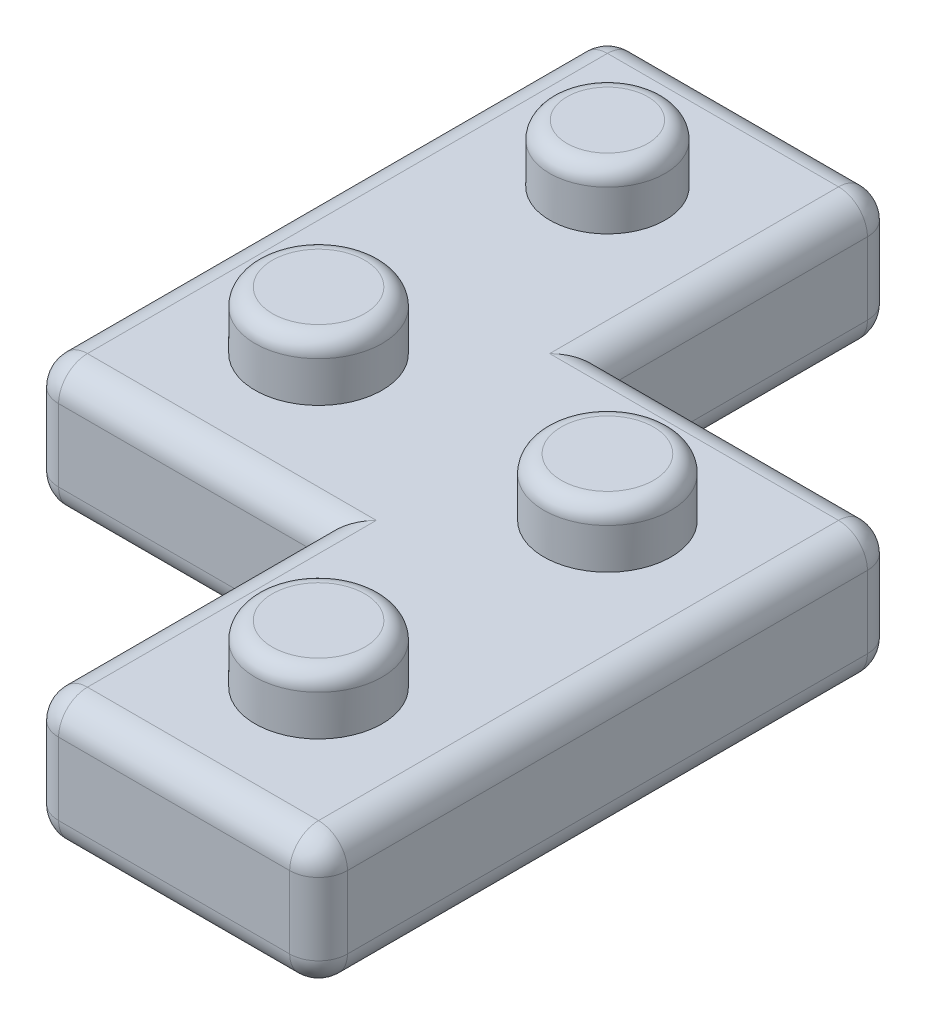
from build123d import *

# Parameters (mm, degrees)
BOSS_EXTRUDE1_DEPTH = 5.715
SKETCH2_R           = 2.794
SKETCH2_R_2         = 2.54
BOSS_EXTRUDE3_DEPTH = 2.54
FILLET1_R           = 1.27
FILLET2_R           = 1.27
FILLET3_R           = 0.762


with BuildPart() as part:
    # Sketch1 → Boss-Extrude1 (new body)
    with BuildSketch(Plane(origin=(0, 0, 0), x_dir=(1, 0, 0), z_dir=(0, 1, 0))):
        Polygon((-5.674598366, 20.311212687), (7.025401634, 20.311212687), (7.025401634, 7.611212687), (19.725401634, 7.611212687), (19.725401634, -17.788787313), (7.025401634, -17.788787313), (7.025401634, -5.088787313), (-5.674598366, -5.088787313), align=None)
    extrude(amount=BOSS_EXTRUDE1_DEPTH)

    # Sketch2 → Boss-Extrude3 (add)
    with BuildSketch(Plane(origin=(0, 5.715, 0), x_dir=(1, 0, 0), z_dir=(0, 1, 0))):
        with Locations(Location((0.675401634, 1.261212687, 0), (0, 0, 90))):
            Circle(SKETCH2_R)
        with Locations(Location((13.375401634, 1.261212687, 0), (0, 0, 90))):
            Circle(SKETCH2_R)
        with Locations(Location((0.675401634, 13.961212687, 0), (0, 0, 90))):
            Circle(SKETCH2_R_2)
        with Locations(Location((13.375401634, -11.438787313, 0), (0, 0, 90))):
            Circle(SKETCH2_R)
    extrude(amount=BOSS_EXTRUDE3_DEPTH)

    # Fillet1
    fillet1_edges = [part.edges().sort_by_distance(p)[0] for p in [
        (7.025401634, 5.715, 11.438787313),
        (0.675401634, 0, 5.088787313),
        (13.375401634, 5.715, 17.788787313),
        (-5.674598366, 2.8575, -20.311212687),
        (7.025401634, 2.8575, -20.311212687),
        (19.725401634, 2.8575, -7.611212687),
        (19.725401634, 2.8575, 17.788787313),
        (7.025401634, 2.8575, 17.788787313),
        (-5.674598366, 2.8575, 5.088787313),
        (19.725401634, 5.715, 5.088787313),
        (13.375401634, 5.715, -7.611212687),
        (7.025401634, 5.715, -13.961212687),
        (0.675401634, 5.715, -20.311212687),
        (-5.674598366, 5.715, -7.611212687),
        (0.675401634, 5.715, 5.088787313),
        (0.675401634, 0, -20.311212687),
        (7.025401634, 0, -13.961212687),
        (13.375401634, 0, -7.611212687),
        (19.725401634, 0, 5.088787313),
        (13.375401634, 0, 17.788787313),
        (7.025401634, 0, 11.438787313),
    ]]
    fillet(fillet1_edges, radius=FILLET1_R)

    # Fillet2
    # the kernel refuses this fillet: 1.27 mm, written as the material it takes off along each edge
    with BuildSketch(Plane(origin=(-4.404598366, 1.27, -19.041212687), x_dir=(0, -1, 0), z_dir=(-1, 0, 0))) as fillet2_piece_1_section:
        Polygon((0, 0), (FILLET2_R, 0), (FILLET2_R, -FILLET2_R), (0, -FILLET2_R), align=None)
    fillet2_piece_1 = extrude(amount=FILLET2_R, mode=Mode.PRIVATE)
    fillet2_piece_1 = fillet2_piece_1 - Plane(origin=(-4.404598366, 1.27, -19.041212687), x_dir=(0, 0.7071067811865475, 0.7071067811865475), z_dir=(-1, 0, 0)) * Sphere(FILLET2_R, mode=Mode.PRIVATE)
    add(fillet2_piece_1, mode=Mode.SUBTRACT)
    with BuildSketch(Plane(origin=(-4.404598366, 1.27, 3.818787313), x_dir=(0, -1, 0), z_dir=(-1, 0, 0))) as fillet2_piece_2_section:
        Polygon((0, 0), (FILLET2_R, 0), (FILLET2_R, FILLET2_R), (0, FILLET2_R), align=None)
    fillet2_piece_2 = extrude(amount=FILLET2_R, mode=Mode.PRIVATE)
    fillet2_piece_2 = fillet2_piece_2 - Plane(origin=(-4.404598366, 1.27, 3.818787313), x_dir=(0, 0.7071067811865475, -0.7071067811865475), z_dir=(-1, 0, 0)) * Sphere(FILLET2_R, mode=Mode.PRIVATE)
    add(fillet2_piece_2, mode=Mode.SUBTRACT)
    with BuildSketch(Plane(origin=(-5.674598366, 0, 3.818787313), x_dir=(0, 1, 0), z_dir=(0, 0, -1))) as fillet2_piece_3:
        with BuildLine():
            CenterArc((FILLET2_R, FILLET2_R), FILLET2_R, 180, 90)
            Line((0, FILLET2_R), (0, 0))
            Line((0, 0), (FILLET2_R, 0))
        make_face()
    extrude(amount=22.86, mode=Mode.SUBTRACT)

    # Fillet3
    fillet3_edges = [part.edges().sort_by_distance(p)[0] for p in [
        (0.675401634, 8.255, 1.532787313),
        (13.375401634, 8.255, 1.532787313),
        (0.675401634, 8.255, -11.421212687),
        (13.375401634, 8.255, 14.232787313),
    ]]
    fillet(fillet3_edges, radius=FILLET3_R)


solid = part.part
